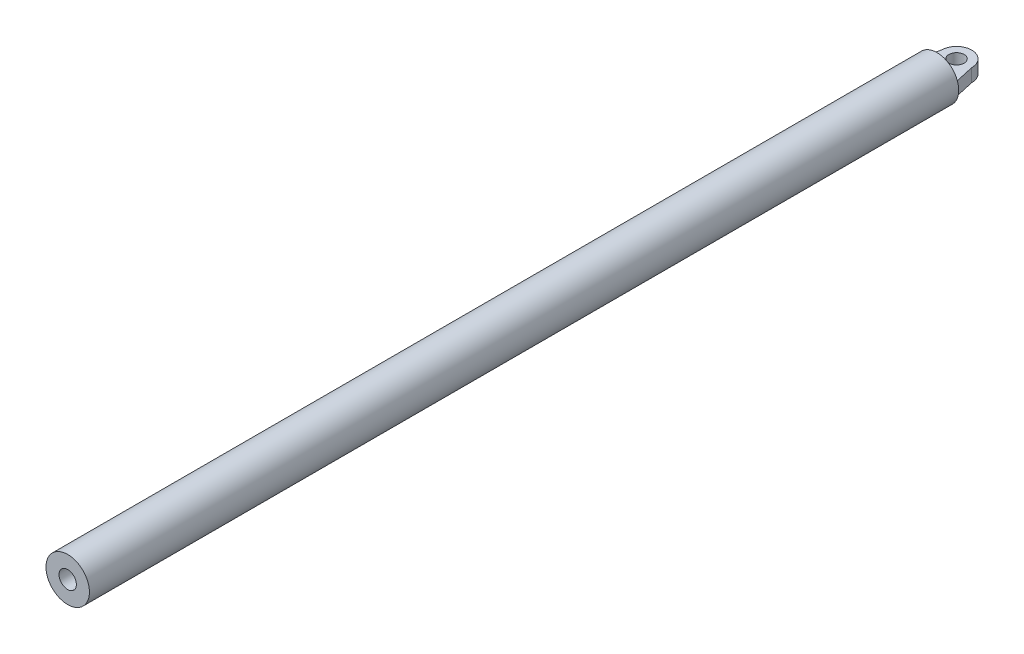
from build123d import *

# Parameters (mm, degrees)
SKETCH1_R           = 50
BOSS_EXTRUDE1_DEPTH = 2000
SKETCH3_R           = 17.5
BOSS_EXTRUDE2_DEPTH = 15
SHELL1_START        = 30
SHELL1_OUTLINE_R    = 20
SHELL1_DEPTH        = 1970


# Read off the part's stored shape, not the designer's step: Shell1
with BuildPart() as part:
    # Sketch1 → Boss-Extrude1 (new body)
    with BuildSketch(Plane.XY):
        Circle(SKETCH1_R)
    extrude(amount=BOSS_EXTRUDE1_DEPTH)

    # Sketch3 → Boss-Extrude2 (add, symmetric)
    with BuildSketch(Plane(origin=(0, 0, 0), x_dir=(1, 0, 0), z_dir=(0, 1, 0))):
        with BuildLine():
            ThreePointArc((-35, 45), (0, 80), (35, 45))
            Line((35, 45), (45, 0))
            Line((45, 0), (-45, 0))
            Line((-45, 0), (-35, 45))
        make_face()
        with Locations(Location((0, 45, 0), (0, 0, 270))):
            Circle(SKETCH3_R, mode=Mode.SUBTRACT)
    extrude(amount=BOSS_EXTRUDE2_DEPTH, both=True)

    # Shell1 outline → Shell1 (cut)
    with BuildSketch(Plane.XY.offset(SHELL1_START)):
        Circle(SHELL1_OUTLINE_R)
    extrude(amount=SHELL1_DEPTH, mode=Mode.SUBTRACT)


solid = part.part
